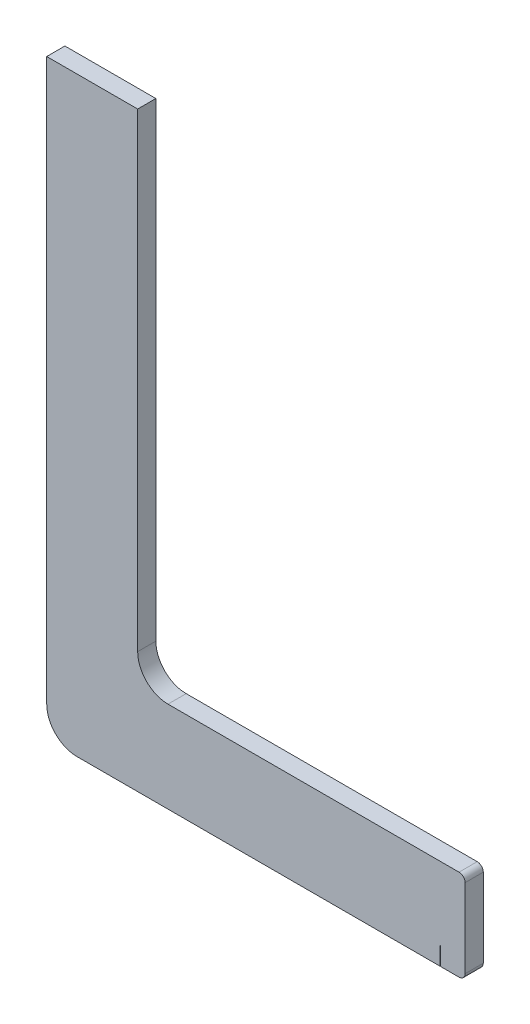
from build123d import *

# Parameters (mm, degrees)
BOSS_EXTRUDE1_DEPTH = 3
SKETCH2_W           = 0.1
SKETCH2_H           = 3
CUT_EXTRUDE2_DEPTH  = 3


with BuildPart() as part:
    # Sketch1 → Boss-Extrude1 (new body)
    with BuildSketch(Plane.XY):
        with BuildLine():
            Line((0, -1), (0, -92.5))
            ThreePointArc((0, -92.5), (1.464466094, -96.035533906), (5, -97.5))
            Line((5, -97.5), (68, -97.5))
            ThreePointArc((68, -97.5), (68.707106781, -97.207106781), (69, -96.5))
            Line((69, -96.5), (69, -83.5))
            ThreePointArc((69, -83.5), (68.707106781, -82.792893219), (68, -82.5))
            Line((68, -82.5), (20, -82.5))
            ThreePointArc((20, -82.5), (16.464466094, -81.035533906), (15, -77.5))
            Line((15, -77.5), (15, -1))
            Line((15, -1), (15, 0))
            Line((15, 0), (14, 0))
            Line((14, 0), (1, 0))
            Line((1, 0), (0, 0))
            Line((0, 0), (0, -1))
        make_face()
    extrude(amount=BOSS_EXTRUDE1_DEPTH)

    # Sketch2 → Cut-Extrude2 (cut)
    with BuildSketch(Plane.XZ.offset(97.5)):
        with Locations((64.9, 1.5)):
            Rectangle(SKETCH2_W, SKETCH2_H)
    extrude(amount=-CUT_EXTRUDE2_DEPTH, mode=Mode.SUBTRACT)


solid = part.part
